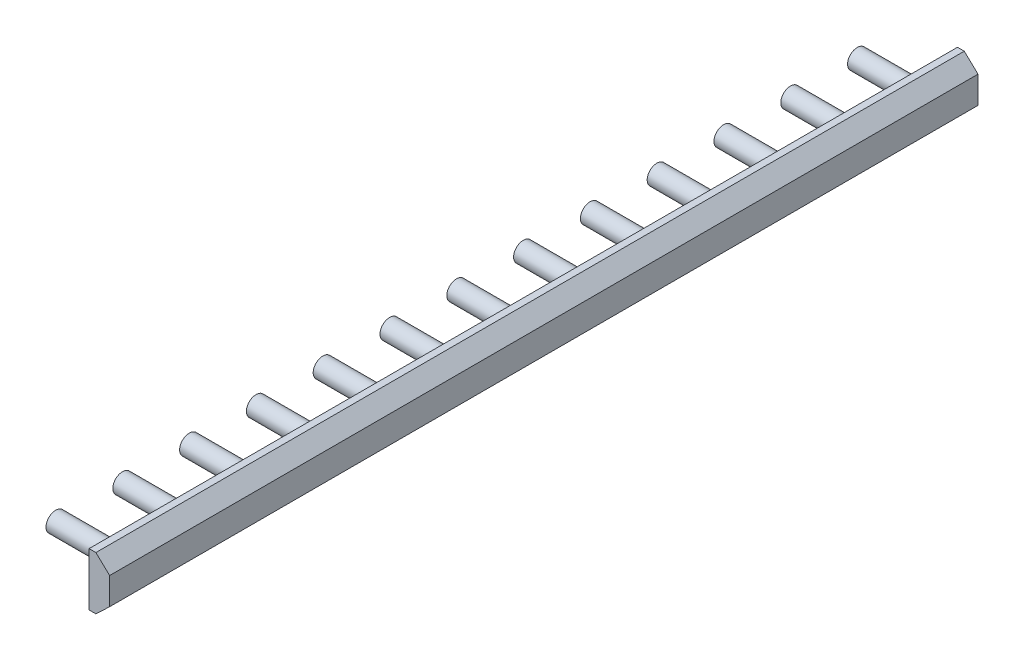
from build123d import *

# Parameters (mm, degrees)
BOSS_EXTRUDE1_DEPTH = 260
SKETCH2_R           = 2.9
BOSS_EXTRUDE2_DEPTH = 20


with BuildPart() as part:
    # Sketch1 → Boss-Extrude1 (new body)
    with BuildSketch(Plane.XY):
        Polygon((0, 7.95), (2.04, 7.95), (6.152414984, 4.048), (6.152414984, -4.048), (2.04, -7.95), (0, -7.95), align=None)
    extrude(amount=BOSS_EXTRUDE1_DEPTH)

    # Sketch2 → Boss-Extrude2 (add)
    with BuildSketch(Plane.ZY):
        with Locations((10, 0)):
            Circle(SKETCH2_R)
        with Locations((30, 0)):
            Circle(SKETCH2_R)
        with Locations((50, 0)):
            Circle(SKETCH2_R)
        with Locations((70, 0)):
            Circle(SKETCH2_R)
        with Locations((90, 0)):
            Circle(SKETCH2_R)
        with Locations((110, 0)):
            Circle(SKETCH2_R)
        with Locations((130, 0)):
            Circle(SKETCH2_R)
        with Locations((150, 0)):
            Circle(SKETCH2_R)
        with Locations((170, 0)):
            Circle(SKETCH2_R)
        with Locations((190, 0)):
            Circle(SKETCH2_R)
        with Locations((210, 0)):
            Circle(SKETCH2_R)
        with Locations((230, 0)):
            Circle(SKETCH2_R)
        with Locations((250, 0)):
            Circle(SKETCH2_R)
    extrude(amount=BOSS_EXTRUDE2_DEPTH)


solid = part.part
